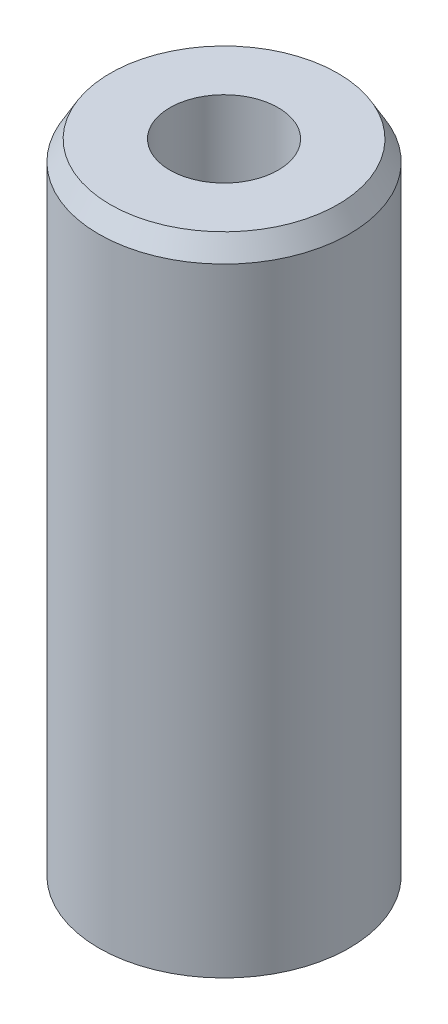
from build123d import *
from OCP.BRepFilletAPI import BRepFilletAPI_MakeChamfer

# Parameters (mm, degrees)
SKETCH1_R           = 10
BOSS_EXTRUDE1_DEPTH = 51.853147241
SKETCH2_R           = 4.323395723
CUT_EXTRUDE1_DEPTH  = 54.747082514
CHAMFER1_SIZE       = 1.584780555
CHAMFER1_SIZE2      = 0.91497348


with BuildPart() as part:
    # Sketch1 → Boss-Extrude1 (new body)
    with BuildSketch(Plane(origin=(0, 0, 0), x_dir=(1, 0, 0), z_dir=(0, 1, 0))):
        Circle(SKETCH1_R)
    extrude(amount=BOSS_EXTRUDE1_DEPTH)

    # Sketch2 → Cut-Extrude1 (cut, through all)
    with BuildSketch(Plane(origin=(0, 0, 0), x_dir=(1, 0, 0), z_dir=(0, 1, 0))):
        Circle(SKETCH2_R)
    extrude(amount=CUT_EXTRUDE1_DEPTH, mode=Mode.SUBTRACT)

    # Chamfer1: one chamfer whose edges measure the first distance from different faces: ONE call of the kernel's chamfer builder (chamfer() names one face for all edges)
    chamfer1_edges_1 = [part.edges().sort_by_distance(p)[0] for p in [
        (-10, 51.853147241, 0),
    ]]
    chamfer1_side_1 = [part.faces().sort_by_distance(p)[0] for p in [
        (-10, 25.92657362, 0),
    ]]
    chamfer1_edges_2 = [part.edges().sort_by_distance(p)[0] for p in [
        (-10, 0, 0),
    ]]
    chamfer1_side_2 = [part.faces().sort_by_distance(p)[0] for p in [
        (-9.717157288, 0, 0),
    ]]
    chamfer1 = BRepFilletAPI_MakeChamfer(part.part.solid().wrapped)
    for e in chamfer1_edges_1:
        chamfer1.Add(CHAMFER1_SIZE, CHAMFER1_SIZE2, e.wrapped, chamfer1_side_1[0].wrapped)  # the first distance lies on this face
    for e in chamfer1_edges_2:
        chamfer1.Add(CHAMFER1_SIZE, CHAMFER1_SIZE2, e.wrapped, chamfer1_side_2[0].wrapped)  # the first distance lies on this face
    add(Compound.cast(chamfer1.Shape()), mode=Mode.REPLACE)


solid = part.part
